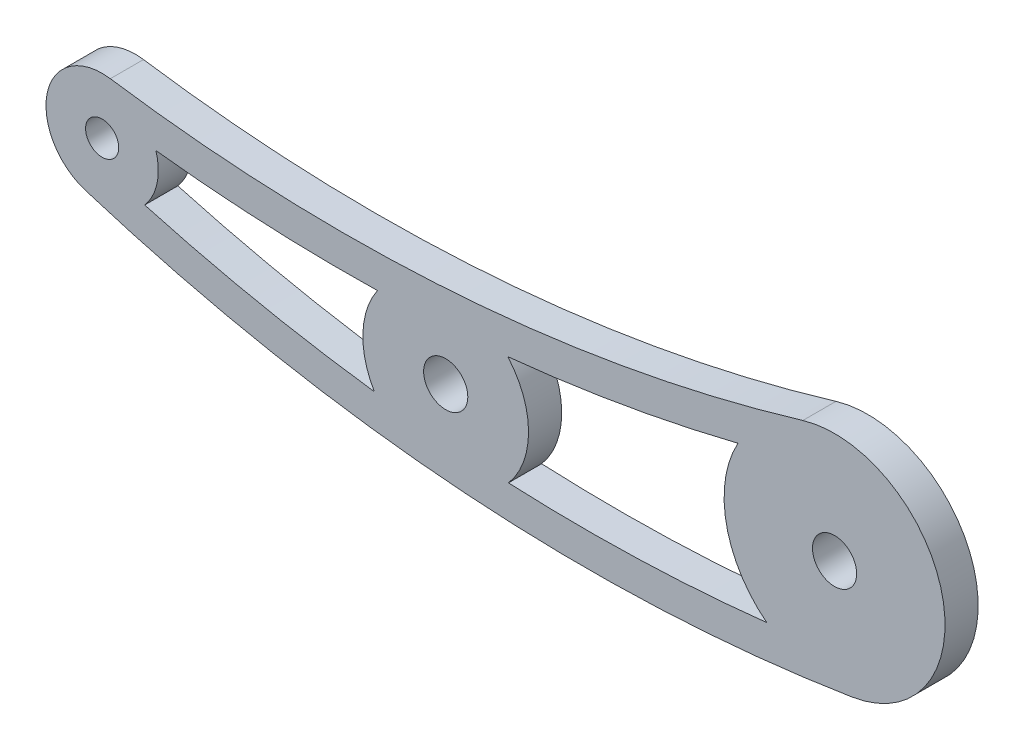
from build123d import *

# Parameters (mm, degrees)
SKETCH1_R           = 1.5
SKETCH1_R_2         = 2
EXTRUDE1_DEPTH      = 3
BOSS_EXTRUDE1_START = -3
SKETCH2_R           = 1.5
SKETCH2_R_2         = 2
BOSS_EXTRUDE1_DEPTH = 3
CUT_EXTRUDE1_START  = -5
SKETCH3_R           = 2
CUT_EXTRUDE1_DEPTH  = 5


with BuildPart() as part:
    # Sketch1 → Extrude1 (new body)
    with BuildSketch(Plane.XY):
        with BuildLine():
            ThreePointArc((-2.193092226, -4.586072393), (33.15, -8), (68.493092226, -4.586072393))
            ThreePointArc((68.493092226, -4.586072393), (71.132119564, 1.578712775), (65.362424897, 4.996265248))
            ThreePointArc((65.362424897, 4.996265248), (33.150000007, 2), (0.937575117, 4.996265246))
            ThreePointArc((0.937575117, 4.996265246), (-4.832119562, 1.578712782), (-2.193092226, -4.586072393))
        make_face()
        Circle(SKETCH1_R, mode=Mode.SUBTRACT)
        with Locations((31.1, -3.74)):
            Circle(SKETCH1_R, mode=Mode.SUBTRACT)
        with Locations((66.3, 0)):
            Circle(SKETCH1_R_2, mode=Mode.SUBTRACT)
    extrude(amount=EXTRUDE1_DEPTH)

    # Sketch2 → Boss-Extrude1 (add)
    with BuildSketch(Plane.XY.offset(3).offset(BOSS_EXTRUDE1_START)):
        with BuildLine():
            ThreePointArc((-1.523614168, -4.849774569), (32.891650058, -11.40834478), (67.892593326, -9.872367826))
            ThreePointArc((67.892593326, -9.872367826), (76.046454518, 2.23754873), (63.427158085, 9.578453911))
            ThreePointArc((63.427158085, 9.578453911), (32.334608499, 3.858874967), (0.742030741, 5.029026137))
            ThreePointArc((0.742030741, 5.029026137), (-4.954835417, 1.136362396), (-1.523614168, -4.849774569))
        make_face()
        with Locations((31.1, -3.74)):
            Circle(SKETCH2_R, mode=Mode.SUBTRACT)
        Circle(SKETCH2_R, mode=Mode.SUBTRACT)
        with Locations((66.3, 0)):
            Circle(SKETCH2_R_2, mode=Mode.SUBTRACT)
    extrude(amount=BOSS_EXTRUDE1_DEPTH)

    # Sketch3 → Cut-Extrude1 (cut)
    with BuildSketch(Plane.XY.offset(3).offset(CUT_EXTRUDE1_START)):
        with Locations((66.3, 0)):
            Circle(SKETCH3_R)
        with Locations((31.1, -3.74)):
            Circle(SKETCH3_R)
        with BuildLine():
            ThreePointArc((3.852185168, -3.316984011), (4.972034413, -1.058577959), (4.86926369, 1.460131712))
            ThreePointArc((4.86926369, 1.460131712), (14.879037339, 0.644485923), (24.921100593, 0.511023655))
            ThreePointArc((24.921100593, 0.511023655), (23.604378321, -3.483766436), (24.645226339, -7.559148726))
            ThreePointArc((24.645226339, -7.559148726), (14.172697484, -5.810622174), (3.852185168, -3.316984011))
        make_face()
        with BuildLine():
            ThreePointArc((57.559699529, 4.858718728), (56.502324822, -2.001389793), (60.165384794, -7.897246119))
            ThreePointArc((60.165384794, -7.897246119), (48.487966367, -8.728733859), (36.781348534, -8.636149389))
            ThreePointArc((36.781348534, -8.636149389), (38.599846278, -3.691981225), (36.718188813, 1.228496198))
            ThreePointArc((36.718188813, 1.228496198), (47.20402982, 2.669943525), (57.559699529, 4.858718728))
        make_face()
    extrude(amount=CUT_EXTRUDE1_DEPTH, mode=Mode.SUBTRACT)


solid = part.part
